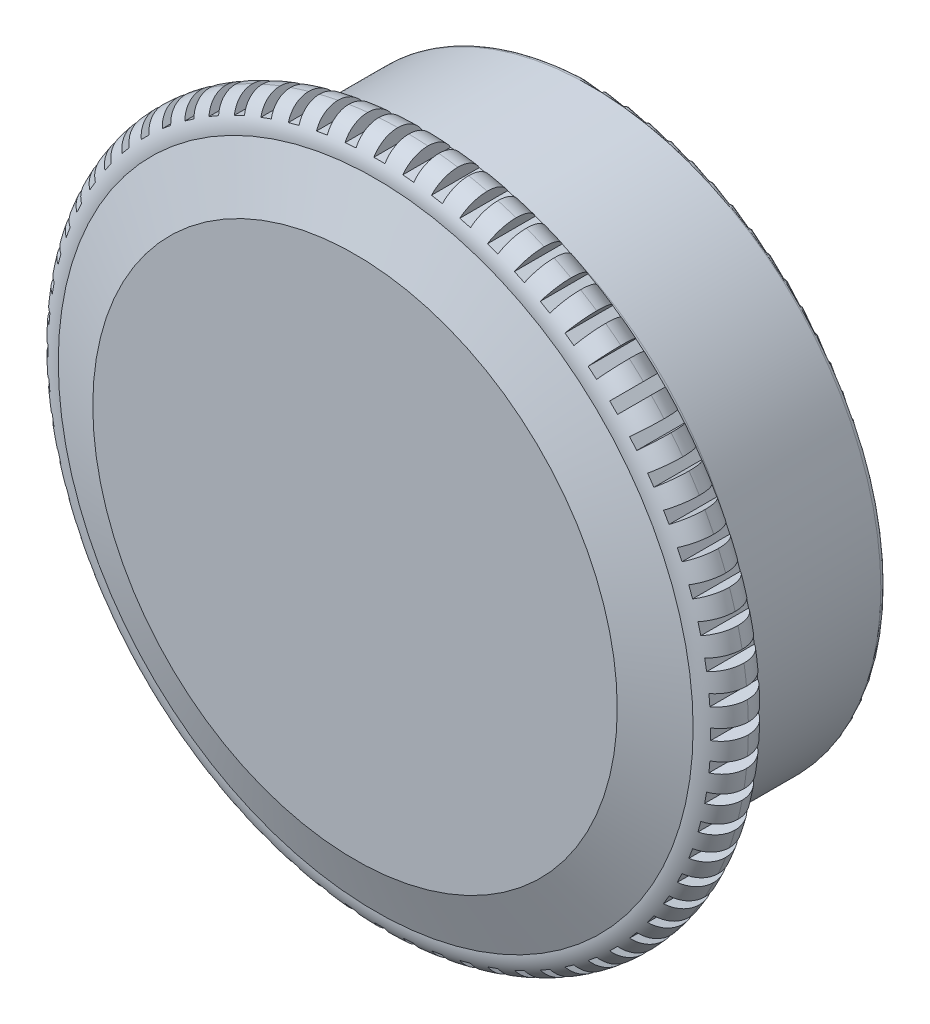
from build123d import *

# Parameters (mm, degrees)
SKICA1_R                 = 10.5
P_IDAT_VYSUNUT_M1_DEPTH  = 6
SKICA2_R                 = 12.5
P_IDAT_VYSUNUT_M2_DEPTH  = 2
ZAOBLIT1_R               = 1
ZAOBLIT2_R               = 1
SKICA4_W                 = 0.4
SKICA4_H                 = 2
ODEBRAT_VYSUNUT_M2_DEPTH = 0.5
KRUHOV_POLE1_COUNT       = 72
SKICA6_R                 = 10
ODEBRAT_VYSUNUT_M3_DEPTH = 5
ZAOBLIT3_R               = 0.2


with BuildPart() as part:
    # Skica1 → Přidat vysunutím1 (new body)
    with BuildSketch(Plane.XY):
        Circle(SKICA1_R)
    extrude(amount=P_IDAT_VYSUNUT_M1_DEPTH)

    # Skica2 → Přidat vysunutím2 (add)
    with BuildSketch(Plane.XY.offset(6)):
        Circle(SKICA2_R)
    extrude(amount=P_IDAT_VYSUNUT_M2_DEPTH)

    # Zaoblit1
    zaoblit1_edges = [part.edges().sort_by_distance(p)[0] for p in [
        (-10.5, 0, 6),
    ]]
    fillet(zaoblit1_edges, radius=ZAOBLIT1_R)

    # Zaoblit2
    zaoblit2_edges = [part.edges().sort_by_distance(p)[0] for p in [
        (-12.5, 0, 6),
        (-12.5, 0, 8),
    ]]
    fillet(zaoblit2_edges, radius=ZAOBLIT2_R - 0.0001)  # a hair under: the kernel refuses the full size

    # Skica4 → Odebrat vysunutím2 (cut)
    with BuildSketch(Plane(origin=(0, 12.5, 0), x_dir=(1, 0, 0), z_dir=(0, 1, 0))):
        with Locations((0, -7)):
            Rectangle(SKICA4_W, SKICA4_H)
    odebrat_vysunut_m2 = extrude(amount=-ODEBRAT_VYSUNUT_M2_DEPTH, mode=Mode.SUBTRACT)

    # Kruhové pole1: Odebrat vysunutím2 ×72 about axis
    kruhov_pole1_axis = Axis((0, 0, 0), (0, 0, 1))
    for i in range(1, KRUHOV_POLE1_COUNT):
        add(odebrat_vysunut_m2.rotate(kruhov_pole1_axis, i * 360 / KRUHOV_POLE1_COUNT), mode=Mode.SUBTRACT)

    # Skica5 → Rotovat1 (revolve)
    with BuildSketch(Plane(origin=(0, 0, 0), x_dir=(1, 0, 0), z_dir=(0, 1, 0)), mode=Mode.PRIVATE) as rotovat1_sk:
        Polygon((-11.5, -8), (-9.5, -8.749420569), (0, -8.749420569), (0, -8), align=None)
    revolve(rotovat1_sk.sketch.rotate(Axis((0, 0, 5), (0, 0, -1)), 180), axis=Axis((0, 0, 5), (0, 0, -1)))

    # Skica6 → Odebrat vysunutím3 (cut)
    with BuildSketch(Plane(origin=(0, 0, 0), x_dir=(-1, 0, 0), z_dir=(0, 0, -1))):
        Circle(SKICA6_R)
    extrude(amount=-ODEBRAT_VYSUNUT_M3_DEPTH, mode=Mode.SUBTRACT)

    # Zaoblit3
    zaoblit3_edges = [part.edges().sort_by_distance(p)[0] for p in [
        (-10.5, 0, 0),
    ]]
    fillet(zaoblit3_edges, radius=ZAOBLIT3_R)


solid = part.part
